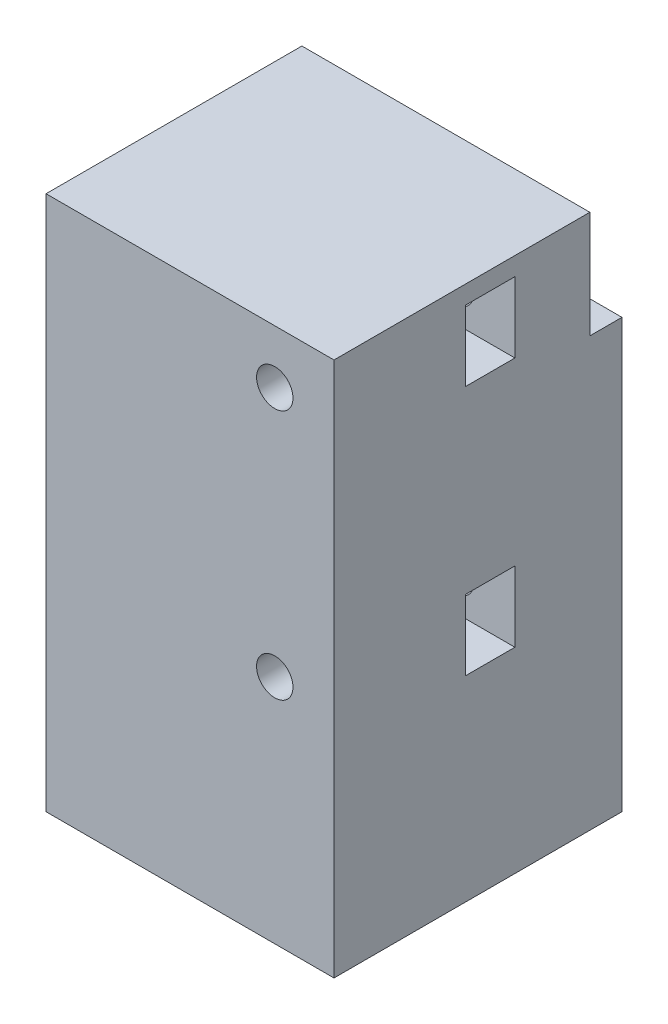
from build123d import *

# Parameters (mm, degrees)
SKETCH1_W           = 26.9
SKETCH1_H           = 26.9
BOSS_EXTRUDE1_DEPTH = 50
SKETCH2_R           = 5.15
CUT_EXTRUDE1_DEPTH  = 40
SKETCH3_W           = 3
SKETCH3_H           = 10
CUT_EXTRUDE2_DEPTH  = 40
SKETCH4_R           = 1.7
CUT_EXTRUDE3_DEPTH  = 63.826905065
CUT_EXTRUDE4_DEPTH  = 4.6


with BuildPart() as part:
    # Sketch1 → Boss-Extrude1 (new body)
    with BuildSketch(Plane(origin=(0, 0, 0), x_dir=(1, 0, 0), z_dir=(0, 1, 0))):
        with Locations((-13.45, 13.45)):
            Rectangle(SKETCH1_W, SKETCH1_H)
    extrude(amount=BOSS_EXTRUDE1_DEPTH)

    # Sketch2 → Cut-Extrude1 (cut)
    with BuildSketch(Plane.XZ):
        with Locations((-16.75, -16.75)):
            Circle(SKETCH2_R)
    extrude(amount=-CUT_EXTRUDE1_DEPTH, mode=Mode.SUBTRACT)

    # Sketch3 → Cut-Extrude2 (cut)
    with BuildSketch(Plane(origin=(0, 0, 0), x_dir=(0, 0, -1), z_dir=(1, 0, 0))):
        with Locations((25.4, 45)):
            Rectangle(SKETCH3_W, SKETCH3_H)
    extrude(amount=-CUT_EXTRUDE2_DEPTH, mode=Mode.SUBTRACT)

    # Sketch4 → Cut-Extrude3 (cut, through all)
    with BuildSketch(Plane(origin=(0, 0, -26.9), x_dir=(-1, 0, 0), z_dir=(0, 0, -1))):
        with Locations((5.53322956, 21.6)):
            Circle(SKETCH4_R)
        with Locations((5.53322956, 45)):
            Circle(SKETCH4_R)
    extrude(amount=-CUT_EXTRUDE3_DEPTH, mode=Mode.SUBTRACT)

    # Sketch5 → Cut-Extrude4 (cut)
    with BuildSketch(Plane(origin=(0, 0, -16.9), x_dir=(-1, 0, 0), z_dir=(0, 0, -1))):
        Polygon((5.53322956, 48.290896534), (-4.515320925, 48.290896534), (-4.515320925, 41.709103466), (5.53322956, 41.709103466), (8.38322956, 43.354551733), (8.38322956, 46.645448267), align=None)
        Polygon((8.38322956, 23.245448267), (5.53322956, 24.890896534), (-5.577222103, 24.890896534), (-5.577222103, 18.309103466), (5.53322956, 18.309103466), (8.38322956, 19.954551733), align=None)
    extrude(amount=-CUT_EXTRUDE4_DEPTH, mode=Mode.SUBTRACT)


solid = part.part
